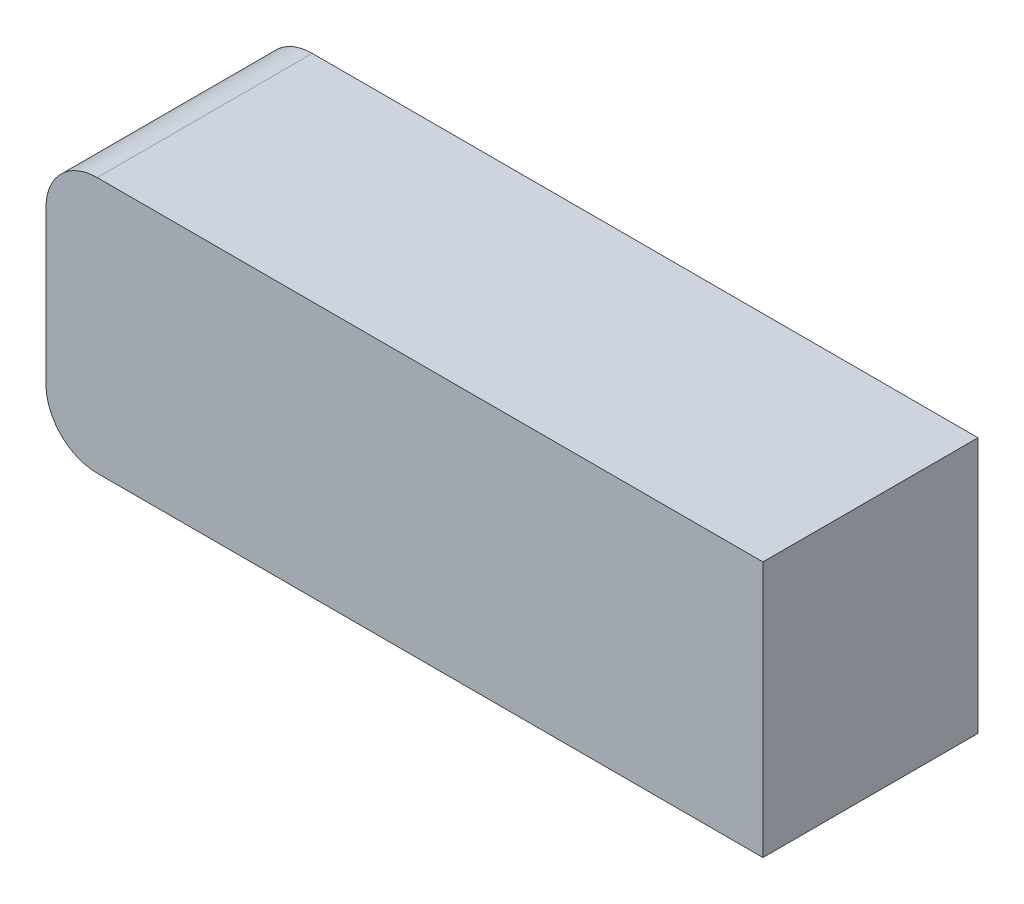
from build123d import *

# Parameters (mm, degrees)
CROQUIS2_W              = 140
CROQUIS2_H              = 42
SALIENTE_EXTRUIR1_DEPTH = 25
REDONDEO1_R             = 10


with BuildPart() as part:
    # Croquis2 → Saliente-Extruir1 (new, symmetric)
    with BuildSketch(Plane(origin=(0, 0, 0), x_dir=(1, 0, 0), z_dir=(0, 1, 0))):
        Rectangle(CROQUIS2_W, CROQUIS2_H)
    extrude(amount=SALIENTE_EXTRUIR1_DEPTH, both=True)

    # Redondeo1
    redondeo1_edges = [part.edges().sort_by_distance(p)[0] for p in [
        (-70, -25, 0),
        (-70, 25, 0),
    ]]
    fillet(redondeo1_edges, radius=REDONDEO1_R)


solid = part.part
